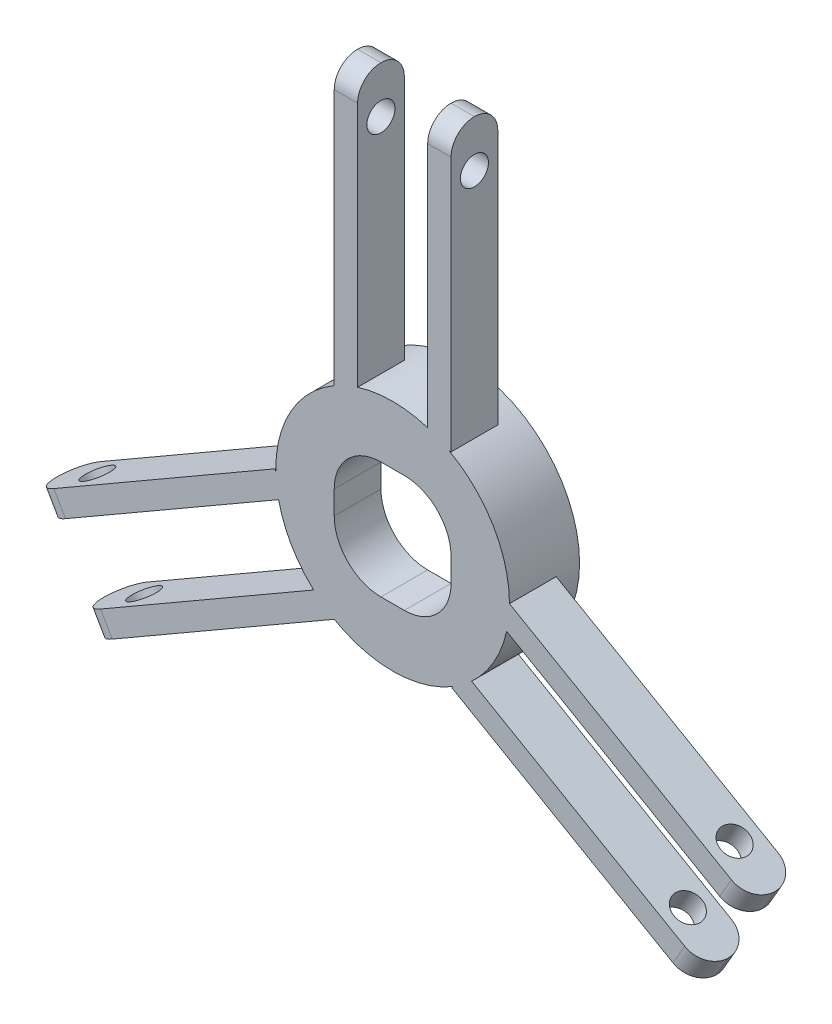
from build123d import *

# Parameters (mm, degrees)
SKETCH1_R                = 25
BOSS_EXTRUDE1_DEPTH      = 10
BOSS_EXTRUDE3_START      = -10
SKETCH2_W                = 5
SKETCH2_H                = 59.633486872
BOSS_EXTRUDE3_DEPTH      = 10
SKETCH3_R                = 3
CUT_EXTRUDE1_DEPTH       = 29
FILLET1_R                = 5
CIRPATTERN1_COUNT        = 3
FILLET1_OF_CIRPATTERN1_R = 5
BOSS_EXTRUDE5_START      = 5
SKETCH5_R                = 25
SKETCH5_R_2              = 22.5
BOSS_EXTRUDE5_DEPTH      = 5


with BuildPart() as part:
    # Sketch1 → Boss-Extrude1 (new body)
    with BuildSketch(Plane.XY):
        Circle(SKETCH1_R)
        with BuildLine():
            Line((-2.5, 12.5), (2.5, 12.5))
            ThreePointArc((2.5, 12.5), (9.571067812, 9.571067812), (12.5, 2.5))
            Line((12.5, 2.5), (12.5, -2.5))
            ThreePointArc((12.5, -2.5), (9.571067812, -9.571067812), (2.5, -12.5))
            Line((2.5, -12.5), (-2.5, -12.5))
            ThreePointArc((-2.5, -12.5), (-9.571067812, -9.571067812), (-12.5, -2.5))
            Line((-12.5, -2.5), (-12.5, 2.5))
            ThreePointArc((-12.5, 2.5), (-9.571067812, 9.571067812), (-2.5, 12.5))
        make_face(mode=Mode.SUBTRACT)
    extrude(amount=BOSS_EXTRUDE1_DEPTH)

    # Sketch2 → Boss-Extrude3 (add)
    with BuildSketch(Plane.XY.offset(10).offset(BOSS_EXTRUDE3_START)):
        with BuildLine():
            Line((-7.5, 81.5), (-12.5, 81.5))
            Line((-12.5, 81.5), (-12.5, 21.650635095))
            ThreePointArc((-12.5, 21.650635095), (-10.060200326, 22.886510643), (-7.5, 23.848480035))
            Line((-7.5, 23.848480035), (-7.5, 81.5))
        make_face()
        with Locations((10, 51.683256564)):
            Rectangle(SKETCH2_W, SKETCH2_H)
    boss_extrude3 = extrude(amount=BOSS_EXTRUDE3_DEPTH)

    # Sketch3 → Cut-Extrude1 (cut)
    with BuildSketch(Plane(origin=(12.5, 0, 0), x_dir=(0, 0, -1), z_dir=(1, 0, 0))):
        with Locations((-5, 71.5)):
            Circle(SKETCH3_R)
    cut_extrude1 = extrude(amount=-CUT_EXTRUDE1_DEPTH, mode=Mode.SUBTRACT)

    # Fillet1
    fillet1_edges = [part.edges().sort_by_distance(p)[0] for p in [
        (-10, 81.5, 10),
        (-10, 81.5, 0),
        (10, 81.5, 10),
        (10, 81.5, 0),
    ]]
    fillet(fillet1_edges, radius=FILLET1_R - 0.0001)  # a hair under: the kernel refuses the full size

    # CirPattern1: Boss-Extrude3, Cut-Extrude1 ×3 about axis
    cirpattern1_axis = Axis((0, 0, 0), (0, 0, 1))
    add([boss_extrude3.rotate(cirpattern1_axis, i * 360 / CIRPATTERN1_COUNT) for i in range(1, CIRPATTERN1_COUNT)])
    add([cut_extrude1.rotate(cirpattern1_axis, i * 360 / CIRPATTERN1_COUNT) for i in range(1, CIRPATTERN1_COUNT)], mode=Mode.SUBTRACT)

    # Fillet1 of CirPattern1
    fillet1_of_cirpattern1_edges = [part.edges().sort_by_distance(p)[0] for p in [
        (-65.581070408, -49.410254038, 10),
        (-65.581070408, -49.410254038, 0),
        (-75.581070408, -32.089745962, 10),
        (-75.581070408, -32.089745962, 0),
        (75.581070408, -32.089745962, 10),
        (75.581070408, -32.089745962, 0),
        (65.581070408, -49.410254038, 10),
        (65.581070408, -49.410254038, 0),
    ]]
    fillet(fillet1_of_cirpattern1_edges, radius=FILLET1_OF_CIRPATTERN1_R - 0.0001)  # a hair under: the kernel refuses the full size

    # Sketch5 → Boss-Extrude5 (add)
    with BuildSketch(Plane(origin=(0, 0, 0), x_dir=(-1, 0, 0), z_dir=(0, 0, -1)).offset(BOSS_EXTRUDE5_START)):
        Circle(SKETCH5_R)
        Circle(SKETCH5_R_2, mode=Mode.SUBTRACT)
    extrude(amount=-BOSS_EXTRUDE5_DEPTH)


solid = part.part
